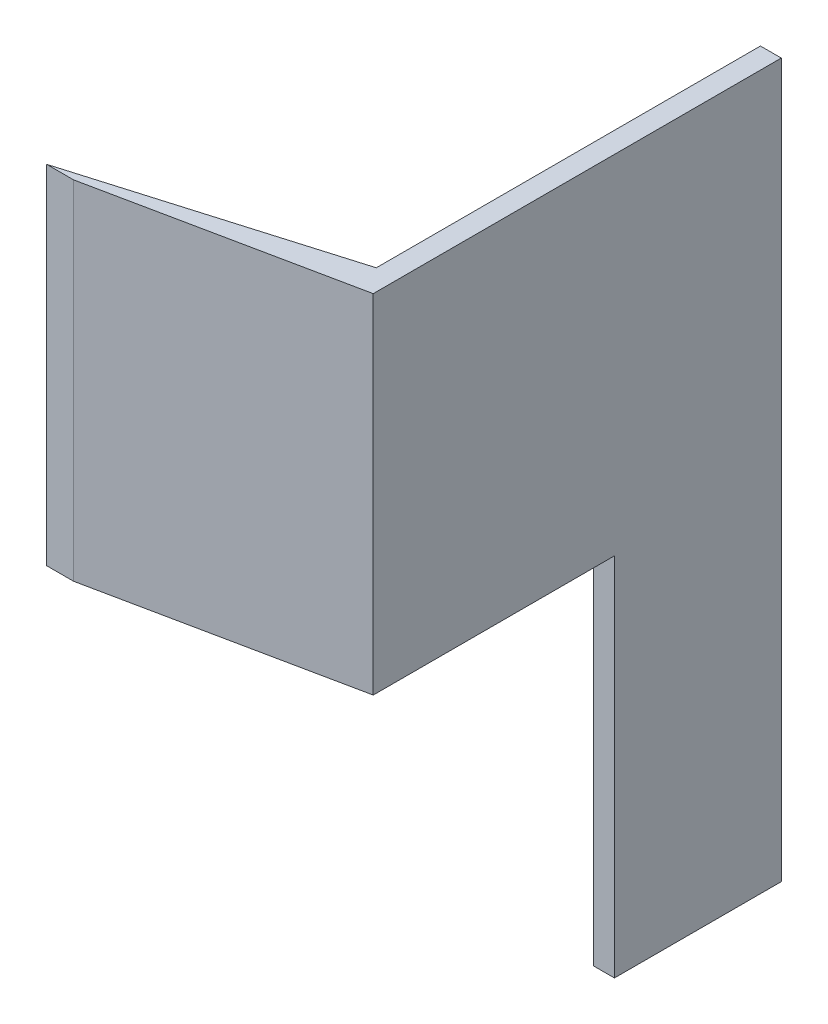
from build123d import *

# Parameters (mm, degrees)
BOSS_EXTRUDE1_DEPTH = 50
SKETCH2_W           = 3
SKETCH2_H           = 24
BOSS_EXTRUDE2_DEPTH = 52.58


with BuildPart() as part:
    # Sketch1 → Boss-Extrude1 (new body)
    with BuildSketch(Plane(origin=(0, 0, 0), x_dir=(1, 0, 0), z_dir=(0, 1, 0))):
        Polygon((3, 46.72), (3, 0), (3, -8.527125288), (-8.16140534, -11.826136958), (-33.586790943, -19.341198123), (-29.724787296, -19.341198123), (-7.554025616, -14.764008615), (6, -11.965758165), (6, 46.72), align=None)
    extrude(amount=BOSS_EXTRUDE1_DEPTH)

    # Sketch2 → Boss-Extrude2 (add)
    with BuildSketch(Plane.XZ):
        with Locations((4.5, -34.72)):
            Rectangle(SKETCH2_W, SKETCH2_H)
    extrude(amount=BOSS_EXTRUDE2_DEPTH)


solid = part.part
